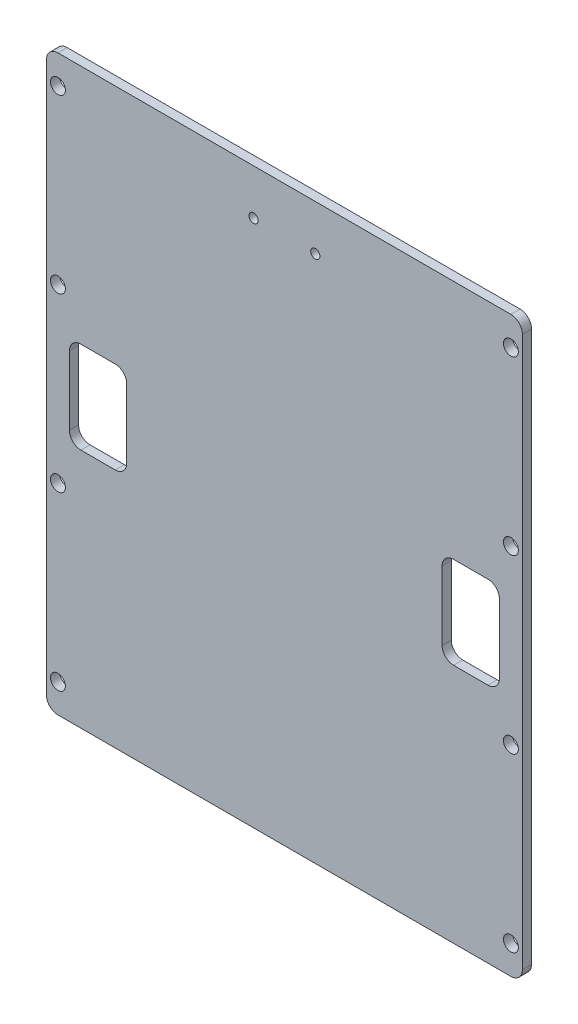
from build123d import *

# Parameters (mm, degrees)
BOARDOUTLINE_DEPTH   = 1.6
SKETCH2_R            = 0.8
COMPONENTHOLES_DEPTH = 65.998538445
WINDOWS_1SIDE_DEPTH  = 65.998538445
M2_CLEARANCE_HOLE1_D = 2.6


with BuildPart() as part:
    # Sketch1 → boardOutline (new body)
    with BuildSketch(Plane.XY):
        with BuildLine():
            Line((-39.5, -50), (39.5, -50))
            ThreePointArc((39.5, -50), (40.914213562, -49.414213562), (41.5, -48))
            Line((41.5, -48), (41.5, 48))
            ThreePointArc((41.5, 48), (40.914213562, 49.414213562), (39.5, 50))
            Line((39.5, 50), (-39.5, 50))
            ThreePointArc((-39.5, 50), (-40.914213562, 49.414213562), (-41.5, 48))
            Line((-41.5, 48), (-41.5, -48))
            ThreePointArc((-41.5, -48), (-40.914213562, -49.414213562), (-39.5, -50))
        make_face()
    extrude(amount=BOARDOUTLINE_DEPTH)

    # Sketch2 → componentHoles (cut, through all)
    with BuildSketch(Plane.XY.offset(1.6)):
        with Locations((-5.385, 42.1)):
            Circle(SKETCH2_R)
        with Locations((5.385, 42.1)):
            Circle(SKETCH2_R)
    extrude(amount=-COMPONENTHOLES_DEPTH, mode=Mode.SUBTRACT)

    # Sketch3 → windows_1side (cut, through all)
    with BuildSketch(Plane.XY.offset(1.6)):
        with BuildLine():
            Line((37.5, -6), (37.5, 6))
            ThreePointArc((37.5, 6), (36.914213562, 7.414213562), (35.5, 8))
            Line((35.5, 8), (29.5, 8))
            ThreePointArc((29.5, 8), (28.085786438, 7.414213562), (27.5, 6))
            Line((27.5, 6), (27.5, -6))
            ThreePointArc((27.5, -6), (28.085786438, -7.414213562), (29.5, -8))
            Line((29.5, -8), (35.5, -8))
            ThreePointArc((35.5, -8), (36.914213562, -7.414213562), (37.5, -6))
        make_face()
        with BuildLine():
            Line((-29.5, -8), (-35.5, -8))
            ThreePointArc((-35.5, -8), (-36.914213562, -7.414213562), (-37.5, -6))
            Line((-37.5, -6), (-37.5, 6))
            ThreePointArc((-37.5, 6), (-36.914213562, 7.414213562), (-35.5, 8))
            Line((-35.5, 8), (-29.5, 8))
            ThreePointArc((-29.5, 8), (-28.085786438, 7.414213562), (-27.5, 6))
            Line((-27.5, 6), (-27.5, -6))
            ThreePointArc((-27.5, -6), (-28.085786438, -7.414213562), (-29.5, -8))
        make_face()
    extrude(amount=-WINDOWS_1SIDE_DEPTH, mode=Mode.SUBTRACT)

    # M2 Clearance Hole1 (through all)
    with Locations(Plane(origin=(0, 0, 0), x_dir=(-1, 0, 0), z_dir=(0, 0, -1))):
        with Locations((39.5, 45), (39.5, -15), (39.5, -45), (39.5, 15)):
            m2_clearance_hole1 = Hole(M2_CLEARANCE_HOLE1_D / 2)

    # Mirror1: M2 Clearance Hole1 across plane
    add(m2_clearance_hole1.mirror(Plane(origin=(0, 0, 0), x_dir=(0, 0, 1), z_dir=(1, 0, 0))), mode=Mode.SUBTRACT)


solid = part.part
